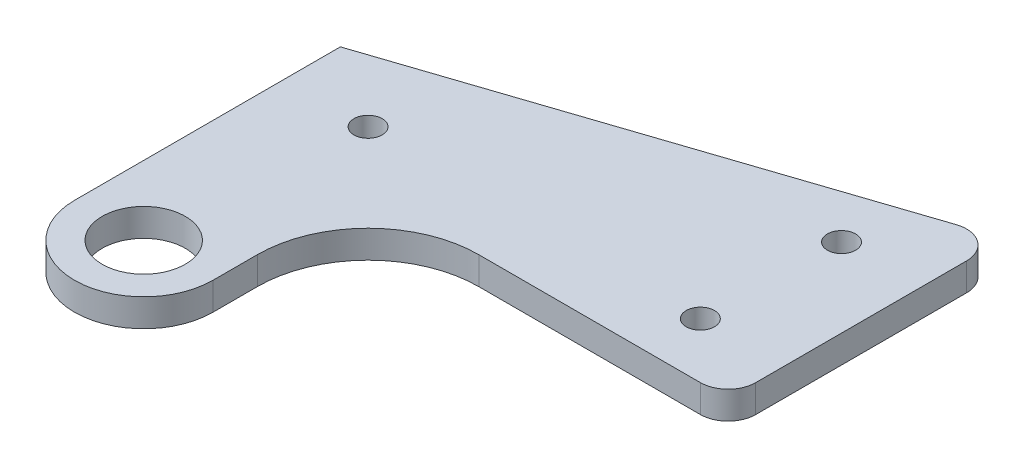
from build123d import *

# Parameters (mm, degrees)
SKETCH_1_R      = 2.55
SKETCH_1_R_2    = 7.5
EXTRUDE_1_DEPTH = 5
FILLET_1_R      = 20
FILLET_2_R      = 5


with BuildPart() as part:
    # ｽｹｯﾁ1 → ﾎﾞｽ - 押し出し1 (new body)
    with BuildSketch(Plane(origin=(0, 0, 0), x_dir=(1, 0, 0), z_dir=(0, 1, 0))):
        with BuildLine():
            Line((0, 0), (0, -48))
            ThreePointArc((0, -48), (12.5, -60.5), (25, -48))
            Line((25, -48), (25, -20))
            Line((25, -20), (90, -20))
            Line((90, -20), (90, 30))
            Line((90, 30), (0, 0))
        make_face()
        with Locations((75.769750529, 14.715657976)):
            Circle(SKETCH_1_R, mode=Mode.SUBTRACT)
        with Locations((75, -10)):
            Circle(SKETCH_1_R, mode=Mode.SUBTRACT)
        with Locations((15, -10)):
            Circle(SKETCH_1_R, mode=Mode.SUBTRACT)
        with Locations((12.5, -48)):
            Circle(SKETCH_1_R_2, mode=Mode.SUBTRACT)
    extrude(amount=EXTRUDE_1_DEPTH)

    # ﾌｨﾚｯﾄ1
    fillet_1_edges = [part.edges().sort_by_distance(p)[0] for p in [
        (25, 2.5, 20),
    ]]
    fillet(fillet_1_edges, radius=FILLET_1_R)

    # ﾌｨﾚｯﾄ2
    fillet_2_edges = [part.edges().sort_by_distance(p)[0] for p in [
        (90, 2.5, -30),
        (90, 2.5, 20),
    ]]
    fillet(fillet_2_edges, radius=FILLET_2_R)


solid = part.part
